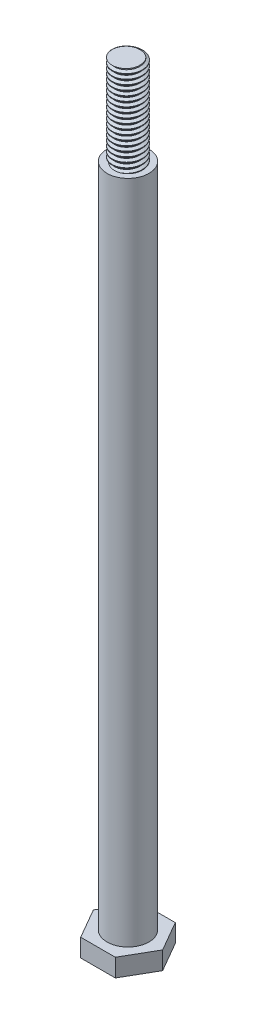
from build123d import *

# Parameters (mm, degrees)
BOSS_EXTRUDE1_DEPTH = 3
SKETCH3_R           = 3.5
BOSS_EXTRUDE2_DEPTH = 111
SKETCH4_R           = 2.1
BOSS_EXTRUDE3_DEPTH = 15
THREAD1_PITCH       = 0.8
SKETCH8_R           = 4.221219118
CUT_EXTRUDE1_DEPTH  = 8


with BuildPart() as part:
    # Sketch1 → Boss-Extrude1 (new body)
    with BuildSketch(Plane(origin=(0, 0, 0), x_dir=(1, 0, 0), z_dir=(0, 1, 0))):
        Polygon((2.886751346, 5), (-2.886751346, 5), (-5.773502692, 0), (-2.886751346, -5), (2.886751346, -5), (5.773502692, 0), align=None)
    extrude(amount=BOSS_EXTRUDE1_DEPTH)

    # Sketch3 → Boss-Extrude2 (add)
    with BuildSketch(Plane(origin=(0, 3, 0), x_dir=(1, 0, 0), z_dir=(0, 1, 0))):
        with Locations(Location((0, 0, 0), (0, 0, 270))):
            Circle(SKETCH3_R)
    extrude(amount=BOSS_EXTRUDE2_DEPTH)

    # Sketch4 → Boss-Extrude3 (add)
    with BuildSketch(Plane(origin=(0, 114, 0), x_dir=(1, 0, 0), z_dir=(0, 1, 0))):
        with Locations(Location((0, 0, 0), (0, 0, 270))):
            Circle(SKETCH4_R)
    extrude(amount=BOSS_EXTRUDE3_DEPTH)

    # Thread1: the profile of Thread Profile1 profile screwed along a right-hand helix of 20 turns, 8 arcs to a turn; built about Z, then put on its axis
    thread1_z = Axis((0, 0, 0), (0, 0, 1))
    thread1_corners = [(2.0997, 0, -0.000173205), (2.5330127, 0, 0.249999999), (2.5330127, 0, 0.349999999), (2.0997, 0, 0.600173203)]
    with BuildLine(mode=Mode.PRIVATE) as thread1_profile:
        Line(thread1_corners[0], thread1_corners[1])
        Line(thread1_corners[1], thread1_corners[2])
        Line(thread1_corners[2], thread1_corners[3])
        Line(thread1_corners[3], thread1_corners[0])
    thread1_cap = Face(thread1_profile.wire())
    thread1_turn_angles = [0, 22.5, 45, 67.5, 90, 112.5, 135, 157.5, 180, 202.5, 225, 247.5, 270, 292.5, 315, 337.5, 360]
    thread1_turn_weights = [1, 0.9238795325112867, 1, 0.9238795325112867, 1, 0.9238795325112867, 1, 0.9238795325112867, 1, 0.9238795325112867, 1, 0.9238795325112867, 1, 0.9238795325112867, 1, 0.9238795325112867, 1]
    thread1_turn_rails = [Edge.make_bspline([Vector(p[0], p[1], 0).rotate(thread1_z, thread1_turn_angles[k]) / thread1_turn_weights[k] + Vector(0, 0, p[2] + THREAD1_PITCH * thread1_turn_angles[k] / 360) for k in range(17)], [0, 0, 0, 1, 1, 2, 2, 3, 3, 4, 4, 5, 5, 6, 6, 7, 7, 8, 8, 8], 2, thread1_turn_weights) for p in thread1_corners]
    thread1_turn_sides = [Face.make_surface_from_curves(thread1_turn_rails[p[0]], thread1_turn_rails[p[1]]) for p in [(0, 1), (1, 2), (2, 3), (3, 0)]]
    thread1 = Plane(origin=(0, 130, 0), x_dir=(-1, 0, 0), z_dir=(0, -1, 0)) * Solid(Shell([*[p.moved(Location((0, 0, THREAD1_PITCH * i))) for i in range(20) for p in thread1_turn_sides], thread1_cap, thread1_cap.rotate(thread1_z, 7200).moved(Location((0, 0, THREAD1_PITCH * 7200 / 360)))]))
    add(thread1)

    # Sketch8 → Cut-Extrude1 (cut)
    with BuildSketch(Plane(origin=(0, 129, 0), x_dir=(1, 0, 0), z_dir=(0, 1, 0))):
        Circle(SKETCH8_R)
    extrude(amount=CUT_EXTRUDE1_DEPTH, mode=Mode.SUBTRACT)


solid = part.part
